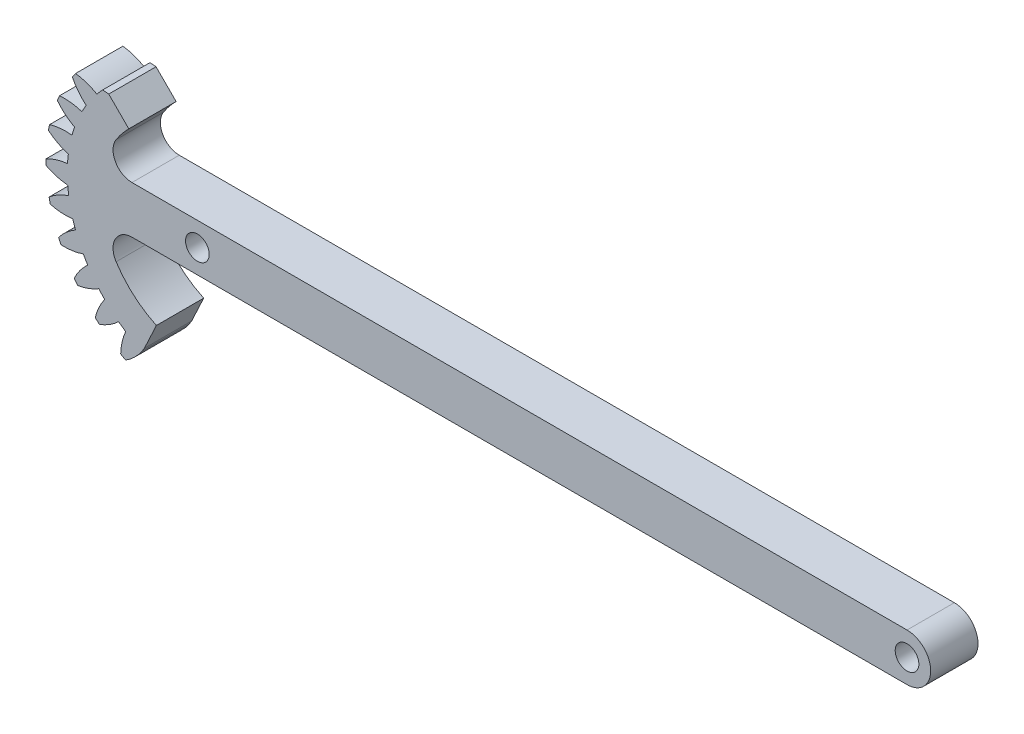
from build123d import *

# Parameters (mm, degrees)
SKETCH1_R                       = 2.5
BOSS_EXTRUDE1_DEPTH             = 5
BOSS_EXTRUDE2_REACH             = 157.161
BOSS_EXTRUDE2_DIRECTION_2_REACH = 157.161
FILLET1_R                       = 4
BOSS_EXTRUDE3_REACH             = 158.929
BOSS_EXTRUDE3_DIRECTION_2_REACH = 158.929


with BuildPart() as part:
    # Sketch1 → Boss-Extrude1 (new, symmetric)
    with BuildSketch(Plane.XY):
        with BuildLine():
            Line((0, 5), (150, 5))
            ThreePointArc((150, 5), (155, 0), (150, -5))
            Line((150, -5), (0, -5))
            ThreePointArc((0, -5), (-5, 0), (0, 5))
        make_face()
        Circle(SKETCH1_R, mode=Mode.SUBTRACT)
        with Locations((150, 0)):
            Circle(SKETCH1_R, mode=Mode.SUBTRACT)
    extrude(amount=BOSS_EXTRUDE1_DEPTH, both=True)

    # Boss-Extrude2: up to this face of the body (flat: up to its plane)
    boss_extrude2_end = Plane(part.part.faces().sort_by_distance((75, 0, 5))[0])
    # Sketch2 → Boss-Extrude2 (add, up to the picked face)
    with BuildSketch(Plane.XY, mode=Mode.PRIVATE) as boss_extrude2_sk1:
        with BuildLine():
            Line((0, 5), (-19.880895352, 5))
            ThreePointArc((-19.880895352, 5), (-17.831977334, 10.112891988), (-14.495689014, 14.495689014))
            Line((-14.495689014, 14.495689014), (-18.738329701, 18.738329701))
            ThreePointArc((-18.738329701, 18.738329701), (-26.097405455, -4.601676708), (-11.199383936, -24.017156356))
            Line((-11.199383936, -24.017156356), (-8.663674366, -18.579309634))
            ThreePointArc((-8.663674366, -18.579309634), (-15.804984265, -13.055744803), (-19.880895352, -5))
            Line((-19.880895352, -5), (0, -5))
            ThreePointArc((0, -5), (-5, 0), (0, 5))
        make_face()
    boss_extrude2_tool1 = split(extrude(boss_extrude2_sk1.sketch, amount=BOSS_EXTRUDE2_REACH, mode=Mode.PRIVATE), bisect_by=boss_extrude2_end, keep=Keep.BOTH, mode=Mode.PRIVATE)
    add(boss_extrude2_tool1.solids().sort_by(Axis((-16.92377, -2.181901, 0), (0, 0, 1)))[0])

    # Boss-Extrude2 direction 2: up to this face of the body (flat: up to its plane)
    boss_extrude2_direction_2_end = Plane(part.part.faces().sort_by_distance((75, 0, -5))[0])
    # Sketch2 → Boss-Extrude2 direction 2 (add, up to the picked face)
    with BuildSketch(Plane.XY, mode=Mode.PRIVATE) as boss_extrude2_direction_2_sk1:
        with BuildLine():
            Line((0, 5), (-19.880895352, 5))
            ThreePointArc((-19.880895352, 5), (-17.831977334, 10.112891988), (-14.495689014, 14.495689014))
            Line((-14.495689014, 14.495689014), (-18.738329701, 18.738329701))
            ThreePointArc((-18.738329701, 18.738329701), (-26.097405455, -4.601676708), (-11.199383936, -24.017156356))
            Line((-11.199383936, -24.017156356), (-8.663674366, -18.579309634))
            ThreePointArc((-8.663674366, -18.579309634), (-15.804984265, -13.055744803), (-19.880895352, -5))
            Line((-19.880895352, -5), (0, -5))
            ThreePointArc((0, -5), (-5, 0), (0, 5))
        make_face()
    boss_extrude2_direction_2_tool1 = split(extrude(boss_extrude2_direction_2_sk1.sketch, amount=-BOSS_EXTRUDE2_DIRECTION_2_REACH, mode=Mode.PRIVATE), bisect_by=boss_extrude2_direction_2_end, keep=Keep.BOTH, mode=Mode.PRIVATE)
    add(boss_extrude2_direction_2_tool1.solids().sort_by(Axis((-16.92377, -2.181901, 0), (0, 0, -1)))[0])

    # Fillet1
    fillet1_edges = [part.edges().sort_by_distance(p)[0] for p in [
        (-19.880895352, 5, 0),
        (-19.880895352, -5, 0),
    ]]
    fillet(fillet1_edges, radius=FILLET1_R)

    # Boss-Extrude3: up to this face of the body (flat: up to its plane)
    boss_extrude3_end = Plane(part.part.faces().sort_by_distance((54.076060443, -0.475641479, 5))[0])
    # Sketch3 → Boss-Extrude3 (add, up to the picked face)
    with BuildSketch(Plane.XY, mode=Mode.PRIVATE) as boss_extrude3_sk1:
        with BuildLine():
            Line((-20.021681572, 18.850126473), (-18.738329701, 18.738329701))
            ThreePointArc((-18.738329701, 18.738329701), (-26.097405455, -4.601676708), (-11.199383936, -24.017156356))
            Line((-11.199383936, -24.017156356), (-11.740495753, -24.866760152))
            ThreePointArc((-11.740495753, -24.866760152), (-13.285028006, -26.694922786), (-15.161632939, -28.18022155))
            ThreePointArc((-15.161632939, -28.18022155), (-15.689198292, -27.889945445), (-16.211208299, -27.589793864))
            ThreePointArc((-16.211208299, -27.589793864), (-15.916228139, -25.214768559), (-15.155801776, -22.945515325))
            ThreePointArc((-15.155801776, -22.945515325), (-15.913795355, -22.426460229), (-16.654027901, -21.882375458))
            ThreePointArc((-16.654027901, -21.882375458), (-18.544904802, -23.34946204), (-20.689312393, -24.412135358))
            ThreePointArc((-20.689312393, -24.412135358), (-21.144997381, -24.018515477), (-21.593195195, -23.616390946))
            ThreePointArc((-21.593195195, -23.616390946), (-20.810865531, -21.354595466), (-19.595252032, -19.29303239))
            ThreePointArc((-19.595252032, -19.29303239), (-20.228764011, -18.627724166), (-20.839699114, -17.941625953))
            ThreePointArc((-20.839699114, -17.941625953), (-22.99428027, -18.983517759), (-25.312769616, -19.577121707))
            ThreePointArc((-25.312769616, -19.577121707), (-25.67665862, -19.09736113), (-26.031455844, -18.610838418))
            ThreePointArc((-26.031455844, -18.610838418), (-24.795968239, -16.561124079), (-23.178295746, -14.797351361))
            ThreePointArc((-23.178295746, -14.797351361), (-23.65963861, -14.014867172), (-24.114575477, -13.2167413))
            ThreePointArc((-24.114575477, -13.2167413), (-26.438695352, -13.787902659), (-28.829937344, -13.886493897))
            ThreePointArc((-28.829937344, -13.886493897), (-29.086126667, -13.341560461), (-29.332016961, -12.791902947))
            ThreePointArc((-29.332016961, -12.791902947), (-27.69736815, -11.043852102), (-25.748336714, -9.654955072))
            ThreePointArc((-25.748336714, -9.654955072), (-26.056473471, -8.789493231), (-26.335529176, -7.914221631))
            ThreePointArc((-26.335529176, -7.914221631), (-28.72761258, -7.989690052), (-31.087098468, -7.588959669))
            ThreePointArc((-31.087098468, -7.588959669), (-31.224391407, -7.00266958), (-31.350628185, -6.413899936))
            ThreePointArc((-31.350628185, -6.413899936), (-29.388260166, -5.043910793), (-27.193051814, -4.090590917))
            ThreePointArc((-27.193051814, -4.090590917), (-27.314515408, -3.179976259), (-27.405493878, -2.265812501))
            ThreePointArc((-27.405493878, -2.265812501), (-29.760995288, -1.84228965), (-31.985604216, -0.959751487))
            ThreePointArc((-31.985604216, -0.959751487), (-31.998000412, -0.357728437), (-31.999066521, 0.244421281))
            ThreePointArc((-31.999066521, 0.244421281), (-29.794744192, 1.176473621), (-27.449300062, 1.65255169))
            ThreePointArc((-27.449300062, 1.65255169), (-27.378781953, 2.568520934), (-27.277706992, 3.481623509))
            ThreePointArc((-27.277706992, 3.481623509), (-29.493679692, 4.38562765), (-31.486185577, 5.71140244))
            ThreePointArc((-31.486185577, 5.71140244), (-31.373143255, 6.302847156), (-31.248992102, 6.892060115))
            ThreePointArc((-31.248992102, 6.892060115), (-28.899054926, 7.345440492), (-26.505882182, 7.323469858))
            ThreePointArc((-26.505882182, 7.323469858), (-26.246464348, 8.204761437), (-25.957753417, 9.076895864))
            ThreePointArc((-25.957753417, 9.076895864), (-27.937348768, 10.421871976), (-29.61066954, 12.132940674))
            ThreePointArc((-29.61066954, 12.132940674), (-29.377129193, 12.687958084), (-29.133186778, 13.238482849))
            ThreePointArc((-29.133186778, 13.238482849), (-26.740338287, 13.193376367), (-24.40403006, 12.674317252))
            ThreePointArc((-24.40403006, 12.674317252), (-23.967050306, 13.482414495), (-23.503321459, 14.275464314))
            ThreePointArc((-23.503321459, 14.275464314), (-25.160021644, 16.002630488), (-26.441025156, 18.024211181))
            ThreePointArc((-26.441025156, 18.024211181), (-26.097193619, 18.51854436), (-25.744121396, 19.006320358))
            ThreePointArc((-25.744121396, 19.006320358), (-23.412940551, 18.464698385), (-21.235604722, 17.471236164))
            ThreePointArc((-21.235604722, 17.471236164), (-20.64016116, 18.170821343), (-20.021681572, 18.850126473))
        make_face()
    boss_extrude3_tool1 = split(extrude(boss_extrude3_sk1.sketch, amount=BOSS_EXTRUDE3_REACH, mode=Mode.PRIVATE), bisect_by=boss_extrude3_end, keep=Keep.BOTH, mode=Mode.PRIVATE)
    add(boss_extrude3_tool1.solids().sort_by(Axis((-20.253104, 17.830071, 0), (0, 0, 1)))[0])

    # Boss-Extrude3 direction 2: up to this face of the body (flat: up to its plane)
    boss_extrude3_direction_2_end = Plane(part.part.faces().sort_by_distance((54.076060443, -0.475641479, -5))[0])
    # Sketch3 → Boss-Extrude3 direction 2 (add, up to the picked face)
    with BuildSketch(Plane.XY, mode=Mode.PRIVATE) as boss_extrude3_direction_2_sk1:
        with BuildLine():
            Line((-20.021681572, 18.850126473), (-18.738329701, 18.738329701))
            ThreePointArc((-18.738329701, 18.738329701), (-26.097405455, -4.601676708), (-11.199383936, -24.017156356))
            Line((-11.199383936, -24.017156356), (-11.740495753, -24.866760152))
            ThreePointArc((-11.740495753, -24.866760152), (-13.285028006, -26.694922786), (-15.161632939, -28.18022155))
            ThreePointArc((-15.161632939, -28.18022155), (-15.689198292, -27.889945445), (-16.211208299, -27.589793864))
            ThreePointArc((-16.211208299, -27.589793864), (-15.916228139, -25.214768559), (-15.155801776, -22.945515325))
            ThreePointArc((-15.155801776, -22.945515325), (-15.913795355, -22.426460229), (-16.654027901, -21.882375458))
            ThreePointArc((-16.654027901, -21.882375458), (-18.544904802, -23.34946204), (-20.689312393, -24.412135358))
            ThreePointArc((-20.689312393, -24.412135358), (-21.144997381, -24.018515477), (-21.593195195, -23.616390946))
            ThreePointArc((-21.593195195, -23.616390946), (-20.810865531, -21.354595466), (-19.595252032, -19.29303239))
            ThreePointArc((-19.595252032, -19.29303239), (-20.228764011, -18.627724166), (-20.839699114, -17.941625953))
            ThreePointArc((-20.839699114, -17.941625953), (-22.99428027, -18.983517759), (-25.312769616, -19.577121707))
            ThreePointArc((-25.312769616, -19.577121707), (-25.67665862, -19.09736113), (-26.031455844, -18.610838418))
            ThreePointArc((-26.031455844, -18.610838418), (-24.795968239, -16.561124079), (-23.178295746, -14.797351361))
            ThreePointArc((-23.178295746, -14.797351361), (-23.65963861, -14.014867172), (-24.114575477, -13.2167413))
            ThreePointArc((-24.114575477, -13.2167413), (-26.438695352, -13.787902659), (-28.829937344, -13.886493897))
            ThreePointArc((-28.829937344, -13.886493897), (-29.086126667, -13.341560461), (-29.332016961, -12.791902947))
            ThreePointArc((-29.332016961, -12.791902947), (-27.69736815, -11.043852102), (-25.748336714, -9.654955072))
            ThreePointArc((-25.748336714, -9.654955072), (-26.056473471, -8.789493231), (-26.335529176, -7.914221631))
            ThreePointArc((-26.335529176, -7.914221631), (-28.72761258, -7.989690052), (-31.087098468, -7.588959669))
            ThreePointArc((-31.087098468, -7.588959669), (-31.224391407, -7.00266958), (-31.350628185, -6.413899936))
            ThreePointArc((-31.350628185, -6.413899936), (-29.388260166, -5.043910793), (-27.193051814, -4.090590917))
            ThreePointArc((-27.193051814, -4.090590917), (-27.314515408, -3.179976259), (-27.405493878, -2.265812501))
            ThreePointArc((-27.405493878, -2.265812501), (-29.760995288, -1.84228965), (-31.985604216, -0.959751487))
            ThreePointArc((-31.985604216, -0.959751487), (-31.998000412, -0.357728437), (-31.999066521, 0.244421281))
            ThreePointArc((-31.999066521, 0.244421281), (-29.794744192, 1.176473621), (-27.449300062, 1.65255169))
            ThreePointArc((-27.449300062, 1.65255169), (-27.378781953, 2.568520934), (-27.277706992, 3.481623509))
            ThreePointArc((-27.277706992, 3.481623509), (-29.493679692, 4.38562765), (-31.486185577, 5.71140244))
            ThreePointArc((-31.486185577, 5.71140244), (-31.373143255, 6.302847156), (-31.248992102, 6.892060115))
            ThreePointArc((-31.248992102, 6.892060115), (-28.899054926, 7.345440492), (-26.505882182, 7.323469858))
            ThreePointArc((-26.505882182, 7.323469858), (-26.246464348, 8.204761437), (-25.957753417, 9.076895864))
            ThreePointArc((-25.957753417, 9.076895864), (-27.937348768, 10.421871976), (-29.61066954, 12.132940674))
            ThreePointArc((-29.61066954, 12.132940674), (-29.377129193, 12.687958084), (-29.133186778, 13.238482849))
            ThreePointArc((-29.133186778, 13.238482849), (-26.740338287, 13.193376367), (-24.40403006, 12.674317252))
            ThreePointArc((-24.40403006, 12.674317252), (-23.967050306, 13.482414495), (-23.503321459, 14.275464314))
            ThreePointArc((-23.503321459, 14.275464314), (-25.160021644, 16.002630488), (-26.441025156, 18.024211181))
            ThreePointArc((-26.441025156, 18.024211181), (-26.097193619, 18.51854436), (-25.744121396, 19.006320358))
            ThreePointArc((-25.744121396, 19.006320358), (-23.412940551, 18.464698385), (-21.235604722, 17.471236164))
            ThreePointArc((-21.235604722, 17.471236164), (-20.64016116, 18.170821343), (-20.021681572, 18.850126473))
        make_face()
    boss_extrude3_direction_2_tool1 = split(extrude(boss_extrude3_direction_2_sk1.sketch, amount=-BOSS_EXTRUDE3_DIRECTION_2_REACH, mode=Mode.PRIVATE), bisect_by=boss_extrude3_direction_2_end, keep=Keep.BOTH, mode=Mode.PRIVATE)
    add(boss_extrude3_direction_2_tool1.solids().sort_by(Axis((-20.253104, 17.830071, 0), (0, 0, -1)))[0])


solid = part.part
